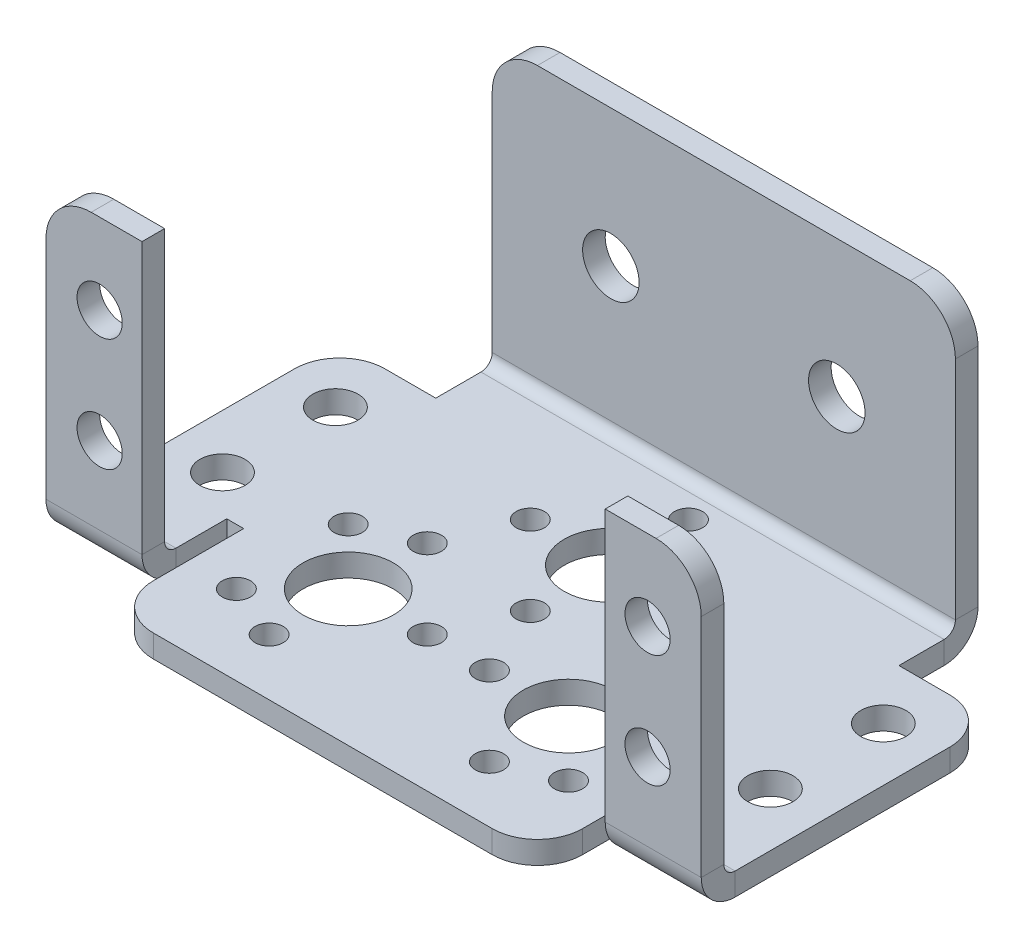
from build123d import *

# Parameters (mm, degrees)
T_LE_DE_BASE_PLI_E1_DEPTH             = 20.5
ESQUISSE8_W                           = 24
ESQUISSE8_H                           = 2
BOSS_EXTRU_1_DEPTH                    = 8.5
T_LE_PLI_E_SUR_AR_TE1_STRIP_W         = 10
T_LE_PLI_E_SUR_AR_TE1_STRIP_H         = 2
T_LE_PLI_E_SUR_AR_TE1_STRIP_CUT_DEPTH = 8.5
T_LE_PLI_E_SUR_AR_TE1_DEPTH           = 8.5
ESQUISSE12_W                          = 1.5
ESQUISSE12_H                          = 12
ENL_V_MAT_EXTRU_1_DEPTH               = 8.5
DIAM_TRE_DU_PER_AGE_4_0_4_1_D         = 4
DIAM_TRE_DU_PER_AGE_8_0_8_1_D         = 8
DIAM_TRE_DU_PER_AGE_2_5_2_5_1_D       = 2.5
R_P_TITION_CIRCULAIRE1_COUNT          = 8
DIAM_TRE_DU_PER_AGE_4_0_4_2_D         = 4
DIAM_TRE_DU_PER_AGE_2_5_2_5_2_D       = 2.5
CONG_1_R                              = 4
DIAM_TRE_DU_PER_AGE_8_0_8_2_D         = 8
DIAM_TRE_DU_PER_AGE_2_5_2_5_3_D       = 2.5
R_P_TITION_CIRCULAIRE2_COUNT          = 4
CROQUIS1_R                            = 2.5
CORTAR_EXTRUIR1_DEPTH                 = 10


# Sheet-metal steps are written as plain solids
with BuildPart() as part:
    # Esquisse1 → Tôle de base pliée1 (new body)
    with BuildSketch(Plane(origin=(0, 0, 0), x_dir=(0, 0, -1), z_dir=(1, 0, 0))):
        with BuildLine():
            Line((0, 27), (0, 3))
            ThreePointArc((0, 3), (-0.878679656, 0.878679656), (-3, 0))
            Line((-3, 0), (-37.5, 0))
            Line((-37.5, 0), (-37.5, 2))
            Line((-37.5, 2), (-3, 2))
            ThreePointArc((-3, 2), (-2.292893219, 2.292893219), (-2, 3))
            Line((-2, 3), (-2, 27))
            Line((-2, 27), (0, 27))
        make_face()
    extrude(amount=T_LE_DE_BASE_PLI_E1_DEPTH)

    # Esquisse8 → Boss.-Extru.1 (add)
    with BuildSketch(Plane(origin=(20.5, 0, 0), x_dir=(0, 0, -1), z_dir=(1, 0, 0))):
        with Locations((-19, 1)):
            Rectangle(ESQUISSE8_W, ESQUISSE8_H)
    extrude(amount=BOSS_EXTRU_1_DEPTH)

    # Tôle pliée sur arête1 strip (across the edge) → Tôle pliée sur arête1 strip cut (cut)
    with BuildSketch(Plane(origin=(20.5, 2, 31), x_dir=(0, 0, -1), z_dir=(1, 0, 0))):
        with Locations((-4, -1)):
            Rectangle(T_LE_PLI_E_SUR_AR_TE1_STRIP_W, T_LE_PLI_E_SUR_AR_TE1_STRIP_H)
    extrude(amount=T_LE_PLI_E_SUR_AR_TE1_STRIP_CUT_DEPTH, mode=Mode.SUBTRACT)

    # Tôle pliée sur arête1 section (across the edge) → Tôle pliée sur arête1 (add)
    with BuildSketch(Plane(origin=(20.5, 2, 31), x_dir=(0, 0, -1), z_dir=(1, 0, 0))):
        with BuildLine():
            Line((-2, 1), (-2, 25))
            Line((-2, 25), (0, 25))
            Line((0, 25), (0, 1))
            ThreePointArc((0, 1), (0.292893219, 0.292893219), (1, 0))
            Line((1, 0), (1, -2))
            ThreePointArc((1, -2), (-1.121320344, -1.121320344), (-2, 1))
        make_face()
    extrude(amount=T_LE_PLI_E_SUR_AR_TE1_DEPTH)

    # Esquisse12 → Enlèv. mat.-Extru.1 (cut)
    with BuildSketch(Plane(origin=(0, 2, 0), x_dir=(1, 0, 0), z_dir=(0, 1, 0))):
        with Locations((19.75, -31.5)):
            Rectangle(ESQUISSE12_W, ESQUISSE12_H)
    extrude(amount=-ENL_V_MAT_EXTRU_1_DEPTH, mode=Mode.SUBTRACT)

    # Diamètre du perçage Ø4.0 (4)1 (through all)
    with Locations(Plane(origin=(0, 2, 0), x_dir=(1, 0, 0), z_dir=(0, 1, 0))):
        with Locations((24.25, -12.13), (24.25, -22.13)):
            Hole(DIAM_TRE_DU_PER_AGE_4_0_4_1_D / 2)

    # Diamètre du perçage Ø8.0 (8)1 (through all)
    with Locations(Plane(origin=(0, 2, 0), x_dir=(1, 0, 0), z_dir=(0, 1, 0))):
        with Locations((9.75, -25.5)):
            Hole(DIAM_TRE_DU_PER_AGE_8_0_8_1_D / 2)

    # Diamètre du perçage Ø2.5 (2.5)1 (through all)
    with Locations(Plane(origin=(0, 2, 0), x_dir=(1, 0, 0), z_dir=(0, 1, 0))):
        with Locations((9.75, -18.5)):
            diam_tre_du_per_age_2_5_2_5_1 = Hole(DIAM_TRE_DU_PER_AGE_2_5_2_5_1_D / 2)

    # Répétition circulaire1: Diamètre du perçage Ø2.5 (2.5)1 ×8 about axis, 3 skipped
    r_p_tition_circulaire1_axis = Axis((9.75, 2, 25.5), (0, 1, 0))
    add([diam_tre_du_per_age_2_5_2_5_1.rotate(r_p_tition_circulaire1_axis, i * 360 / R_P_TITION_CIRCULAIRE1_COUNT) for i in range(1, R_P_TITION_CIRCULAIRE1_COUNT) if i not in (1, 3, 6)], mode=Mode.SUBTRACT)

    # Diamètre du perçage Ø4.0 (4)2 (through all)
    with Locations(Plane.XY.offset(33)):
        with Locations((24.25, 19.87), (24.25, 9.87)):
            Hole(DIAM_TRE_DU_PER_AGE_4_0_4_2_D / 2)

    # Diamètre du perçage Ø2.5 (2.5)2 (through all)
    with Locations(Plane.XY.offset(2)):
        with Locations((10, 14.87)):
            Hole(DIAM_TRE_DU_PER_AGE_2_5_2_5_2_D / 2)

    # Congé1
    cong_1_edges = [part.edges().sort_by_distance(p)[0] for p in [
        (20.5, 27, 1),
        (29, 1, 7),
        (29, 27, 32),
        (19, 1, 37.5),
    ]]
    fillet(cong_1_edges, radius=CONG_1_R)

    # Symétrie1: part across plane


with BuildPart() as part_1:
    add(part.part)
    add(part.part.mirror(Plane(origin=(0, 3, 3), x_dir=(0, 0, 1), z_dir=(1, 0, 0))))

    # Diamètre du perçage Ø8.0 (8)2 (through all)
    with Locations(Plane(origin=(0, 2, 0), x_dir=(1, 0, 0), z_dir=(0, 1, 0))):
        with Locations((0, -12.13)):
            Hole(DIAM_TRE_DU_PER_AGE_8_0_8_2_D / 2)

    # Diamètre du perçage Ø2.5 (2.5)3 (through all)
    with Locations(Plane(origin=(0, 2, 0), x_dir=(1, 0, 0), z_dir=(0, 1, 0))):
        with Locations((0, -5.13)):
            diam_tre_du_per_age_2_5_2_5_3 = Hole(DIAM_TRE_DU_PER_AGE_2_5_2_5_3_D / 2)

    # Répétition circulaire2: Diamètre du perçage Ø2.5 (2.5)3 ×4 about axis
    r_p_tition_circulaire2_axis = Axis((0, 0, 12.13), (0, 1, 0))
    for i in range(1, R_P_TITION_CIRCULAIRE2_COUNT):
        add(diam_tre_du_per_age_2_5_2_5_3.rotate(r_p_tition_circulaire2_axis, i * 360 / R_P_TITION_CIRCULAIRE2_COUNT), mode=Mode.SUBTRACT)

    # Croquis1 → Cortar-Extruir1 (cut)
    with BuildSketch(Plane.XY.offset(2)):
        with Locations((10, 14.87)):
            Circle(CROQUIS1_R)
        with Locations((-10, 14.87)):
            Circle(CROQUIS1_R)
    extrude(amount=-CORTAR_EXTRUIR1_DEPTH, mode=Mode.SUBTRACT)


solid = part_1.part
